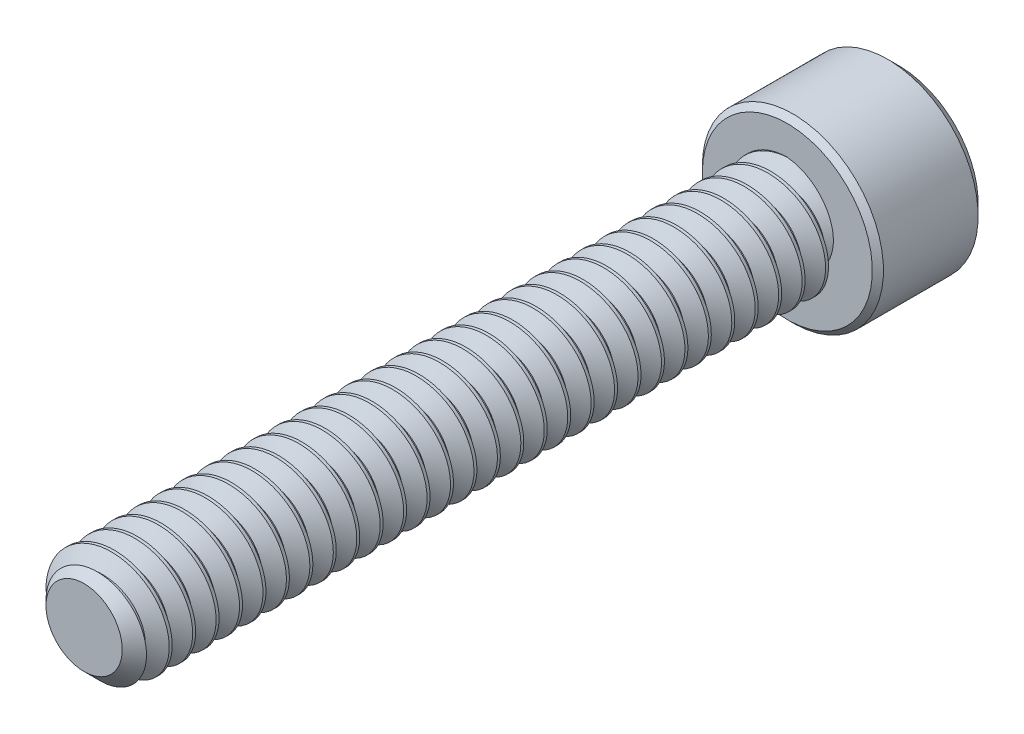
from build123d import *

# Parameters (mm, degrees)
SKETCH1_R          = 1.2573
EXTRUDE1_DEPTH     = 15.875
CHAMFER3_SIZE      = 0.396875
CUT_SWEEP1_PITCH   = 0.529166667
SKETCH6_R          = 2.0447
EXTRUDE2_DEPTH     = 2.5146
CUT_EXTRUDE1_DEPTH = 1.48828125
SKETCH8_R          = 1.14567944
CUT_EXTRUDE2_DEPTH = 0.25146
CUT_EXTRUDE2_DRAFT = -45
CHAMFER1_SIZE      = 0.25146
CHAMFER2_SIZE      = 0.12573


with BuildPart() as part:
    # Sketch1 → Extrude1 (new body)
    with BuildSketch(Plane.XY):
        Circle(SKETCH1_R)
    extrude(amount=-EXTRUDE1_DEPTH)

    # Chamfer3
    chamfer3_edges = [part.edges().sort_by_distance(p)[0] for p in [
        (-1.2573, 0, 0),
    ]]
    chamfer(chamfer3_edges, length=CHAMFER3_SIZE)

    # Cut-Sweep1: arcs per turn and ends read off the stored shape
    # Cut-Sweep1: the profile of Sketch3 profile screwed along a right-hand helix through 32 turns, 6 arcs to a turn; built about Z, then put on its axis
    cut_sweep1_z = Axis((0, 0, 0), (0, 0, 1))
    cut_sweep1_corners = [(1.2576, 0, -0.463194038), (0.913596168, 0, -0.264583333), (0.913596168, 0, -0.1984375), (1.2576, 0, 0.000173205)]
    with BuildLine(mode=Mode.PRIVATE) as cut_sweep1_profile:
        Line(cut_sweep1_corners[0], cut_sweep1_corners[1])
        Line(cut_sweep1_corners[1], cut_sweep1_corners[2])
        Line(cut_sweep1_corners[2], cut_sweep1_corners[3])
        Line(cut_sweep1_corners[3], cut_sweep1_corners[0])
    cut_sweep1_cap = Face(cut_sweep1_profile.wire())
    cut_sweep1_turn_angles = [0, 30, 60, 90, 120, 150, 180, 210, 240, 270, 300, 330, 360]
    cut_sweep1_turn_weights = [1, 0.8660254037844387, 1, 0.8660254037844387, 1, 0.8660254037844387, 1, 0.8660254037844387, 1, 0.8660254037844387, 1, 0.8660254037844387, 1]
    cut_sweep1_turn_rails = [Edge.make_bspline([Vector(p[0], p[1], 0).rotate(cut_sweep1_z, cut_sweep1_turn_angles[k]) / cut_sweep1_turn_weights[k] + Vector(0, 0, p[2] + CUT_SWEEP1_PITCH * cut_sweep1_turn_angles[k] / 360) for k in range(13)], [0, 0, 0, 1, 1, 2, 2, 3, 3, 4, 4, 5, 5, 6, 6, 6], 2, cut_sweep1_turn_weights) for p in cut_sweep1_corners]
    cut_sweep1_turn_sides = [Face.make_surface_from_curves(cut_sweep1_turn_rails[p[0]], cut_sweep1_turn_rails[p[1]]) for p in [(0, 1), (1, 2), (2, 3), (3, 0)]]
    cut_sweep1 = Plane(origin=(0, 0, 0), x_dir=(0, 1, 0), z_dir=(0, 0, -1)) * Solid(Shell([*[p.moved(Location((0, 0, CUT_SWEEP1_PITCH * i))) for i in range(32) for p in cut_sweep1_turn_sides], cut_sweep1_cap, cut_sweep1_cap.rotate(cut_sweep1_z, 11520).moved(Location((0, 0, CUT_SWEEP1_PITCH * 11520 / 360)))]))
    add(cut_sweep1, mode=Mode.SUBTRACT)

    # Sketch6 → Extrude2 (add)
    with BuildSketch(Plane(origin=(0, 0, -15.875), x_dir=(-1, 0, 0), z_dir=(0, 0, -1))):
        Circle(SKETCH6_R)
    extrude(amount=EXTRUDE2_DEPTH)

    # Sketch7 → Cut-Extrude1 (cut)
    with BuildSketch(Plane(origin=(0, 0, -18.3896), x_dir=(-1, 0, 0), z_dir=(0, 0, -1))):
        Polygon((0, 1.14567944), (-0.9921875, 0.57283972), (-0.9921875, -0.57283972), (0, -1.14567944), (0.9921875, -0.57283972), (0.9921875, 0.57283972), align=None)
    extrude(amount=-CUT_EXTRUDE1_DEPTH, mode=Mode.SUBTRACT)


with BuildPart() as cut_extrude2_tool:
    # Sketch8 → Cut-Extrude2 (with draft: the straight prism first)
    with BuildSketch(Plane(origin=(0, 0, -18.3896), x_dir=(-1, 0, 0), z_dir=(0, 0, -1))):
        Circle(SKETCH8_R)
    extrude(amount=-CUT_EXTRUDE2_DEPTH)
    # Cut-Extrude2: the draft: its side faces are tilted about the plane it starts from
    cut_extrude2_sides = [cut_extrude2_tool.faces().sort_by_distance(p)[0] for p in [
        (1.14567944, 0, -18.26387),
    ]]
    draft(cut_extrude2_sides, Plane(origin=(0, 0, -18.3896), x_dir=(-1, 0, 0), z_dir=(0, 0, -1)), CUT_EXTRUDE2_DRAFT)


with BuildPart() as part_1:
    add(part.part)

    # Cut-Extrude2: cut by cut_extrude2_tool
    add(cut_extrude2_tool.part, mode=Mode.SUBTRACT)

    # Chamfer1
    chamfer1_edges = [part_1.edges().sort_by_distance(p)[0] for p in [
        (2.0447, 0, -18.3896),
    ]]
    chamfer(chamfer1_edges, length=CHAMFER1_SIZE)

    # Chamfer2
    chamfer2_edges = [part_1.edges().sort_by_distance(p)[0] for p in [
        (2.0447, 0, -15.875),
    ]]
    chamfer(chamfer2_edges, length=CHAMFER2_SIZE)


solid = part_1.part
